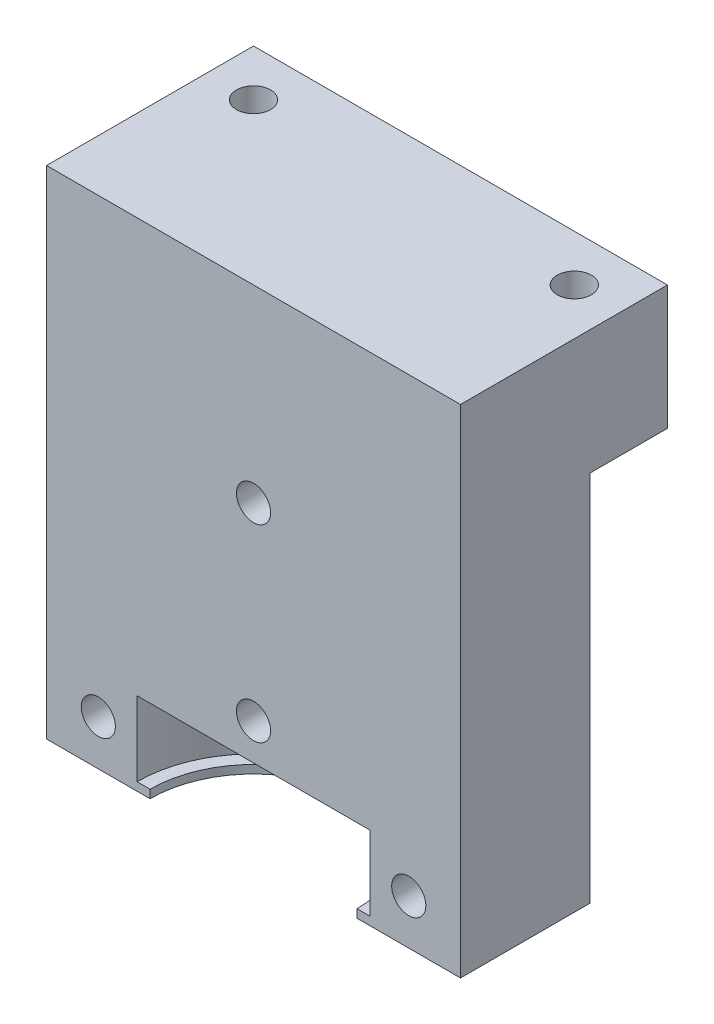
from build123d import *

# Parameters (mm, degrees)
SKETCH1_W             = 40
SKETCH1_H             = 40
BOSS_EXTRUDE1_DEPTH   = 48
M4X0_7_TAPPED_HOLE1_D = 3.3
SKETCH10_W            = 40
SKETCH10_H            = 20
CUT_EXTRUDE4_DEPTH    = 56.713553109
SKETCH11_W            = 11.25
SKETCH11_H            = 7.2
CUT_EXTRUDE5_REACH    = 57.714
SKETCH12_R            = 10
M4X0_7_TAPPED_HOLE2_D = 3.3
SKETCH15_W            = 40
SKETCH15_H            = 7.5
CUT_EXTRUDE6_DEPTH    = 36


with BuildPart() as part:
    # Sketch1 → Boss-Extrude1 (new body)
    with BuildSketch(Plane(origin=(0, 0, 0), x_dir=(1, 0, 0), z_dir=(0, 1, 0))):
        Rectangle(SKETCH1_W, SKETCH1_H)
    extrude(amount=-BOSS_EXTRUDE1_DEPTH)

    # M4x0.7 Tapped Hole1 (through all)
    with Locations(Plane(origin=(0, 0, 0), x_dir=(1, 0, 0), z_dir=(0, 1, 0))):
        with Locations((-15.5, 15.5), (15.5, 15.5), (15.5, -15.5), (-15.5, -15.5)):
            Hole(M4X0_7_TAPPED_HOLE1_D / 2)

    # Sketch10 → Cut-Extrude4 (cut, through all)
    with BuildSketch(Plane(origin=(0, 0, 0), x_dir=(1, 0, 0), z_dir=(0, 1, 0))):
        with Locations((0, -10)):
            Rectangle(SKETCH10_W, SKETCH10_H)
    extrude(amount=-CUT_EXTRUDE4_DEPTH, mode=Mode.SUBTRACT)

    # Sketch11 → Cut-Revolve2 (revolve, cut)
    with BuildSketch(Plane.XY):
        with Locations((5.625, -43.6)):
            Rectangle(SKETCH11_W, SKETCH11_H)
    revolve(axis=Axis((0, 0, 0), (0, -1, 0)), mode=Mode.SUBTRACT)

    # Sketch12 → Cut-Extrude5 (cut, up to next)
    with BuildSketch(Plane.XZ.offset(48), mode=Mode.PRIVATE) as cut_extrude5_sk1:
        Circle(SKETCH12_R)
    cut_extrude5_tool1 = extrude(cut_extrude5_sk1.sketch, amount=-CUT_EXTRUDE5_REACH, mode=Mode.PRIVATE) & part.part
    add(cut_extrude5_tool1.solids().sort_by_distance((0, -48, 0))[0], mode=Mode.SUBTRACT)

    # M4x0.7 Tapped Hole2 (through all)
    with Locations(Plane(origin=(0, 0, -20), x_dir=(-1, 0, 0), z_dir=(0, 0, -1))):
        with Locations((15, -43.628125), (-15, -43.628125), (0, -36.484375), (0, -18.2421875)):
            Hole(M4X0_7_TAPPED_HOLE2_D / 2)

    # Sketch15 → Cut-Extrude6 (cut)
    with BuildSketch(Plane.XZ.offset(48)):
        with Locations((0, -16.25)):
            Rectangle(SKETCH15_W, SKETCH15_H)
    extrude(amount=-CUT_EXTRUDE6_DEPTH, mode=Mode.SUBTRACT)


solid = part.part
